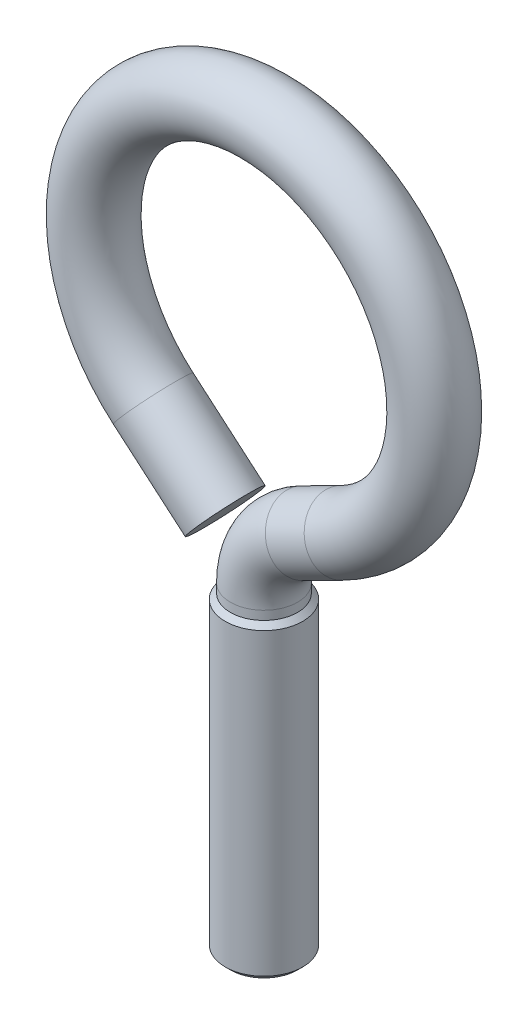
from build123d import *

# Parameters (mm, degrees)
SKETCH29_R    = 1.5
SKETCH28_R    = 1.3
CHAMFER1_SIZE = 0.2


with BuildPart() as part:
    # Sweep1: sweep along a path in Sketch2
    with BuildLine(Plane.XY) as sweep1_path:
        Line((0, 0), (0, -12))
    # Sketch29 → Sweep1 (sweep)
    with BuildSketch(Plane(origin=(0, 0, 0), x_dir=(1, 0, 0), z_dir=(0, 1, 0))):
        Circle(SKETCH29_R)
    sweep(path=sweep1_path.line)

    # Sweep4: sweep along a path in Sketch7
    with BuildLine(Plane.XY) as sweep4_path:
        Line((0, 0), (0, 0.341807316))
        ThreePointArc((0, 0.341807316), (0.39925091, 1.754801875), (1.47892861, 2.749915424))
        Line((1.47892861, 2.749915424), (2.984841176, 3.513513514))
        ThreePointArc((2.984841176, 3.513513514), (0.783200964, 15.953365261), (-4.287966956, 4.382696005))
        Line((-4.287966956, 4.382696005), (-1.5, 2))
    # Sketch28 → Sweep4 (sweep)
    with BuildSketch(Plane(origin=(0, 0, 0), x_dir=(1, 0, 0), z_dir=(0, 1, 0))):
        Circle(SKETCH28_R)
    sweep(path=sweep4_path.line)

    # Chamfer1
    chamfer1_edges = [part.edges().sort_by_distance(p)[0] for p in [
        (-1.5, 0, 0),
        (-1.5, -12, 0),
    ]]
    chamfer(chamfer1_edges, length=CHAMFER1_SIZE - 0.0001)  # a hair under: the kernel refuses the full size


solid = part.part
